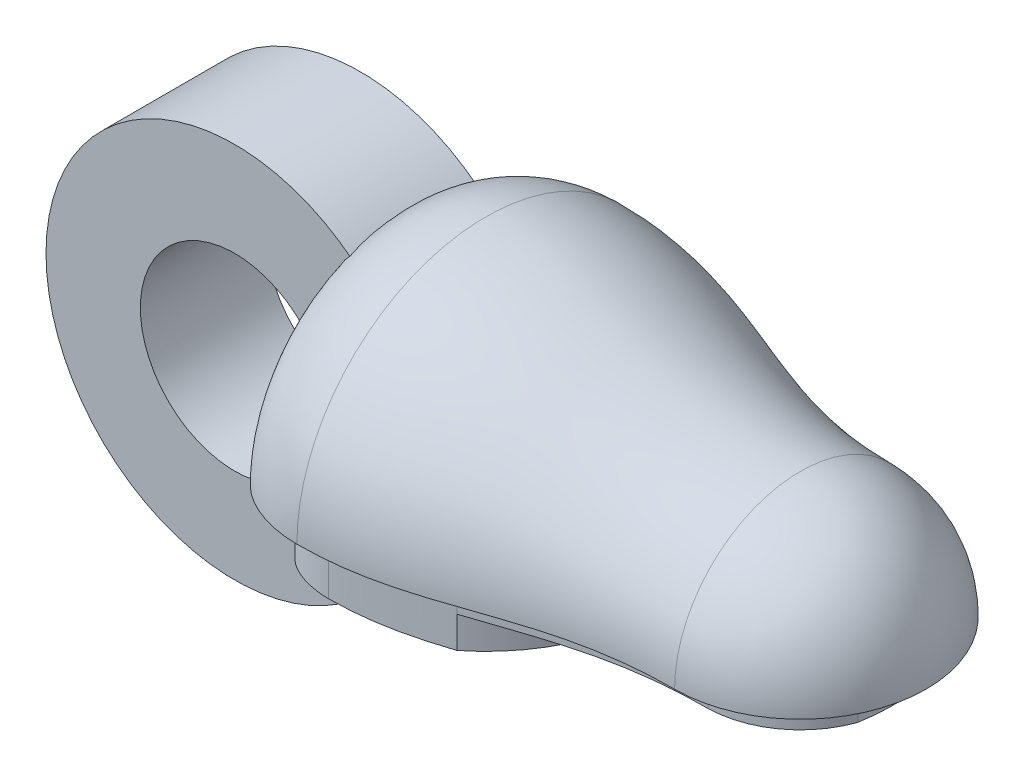
from build123d import *

# Parameters (mm, degrees)
SKETCH6_W               = 12
SKETCH6_H               = 4
BOSS_EXTRUDE2_DEPTH     = 6
SKETCH7_R               = 16
SKETCH7_R_2             = 6
CUT_EXTRUDE_THIN2_DEPTH = 12
SKETCH8_R               = 3
CUT_EXTRUDE2_DEPTH      = 12
REVOLVE1_ANGLE          = 180
BOSS_EXTRUDE11_DEPTH    = 2
BOSS_EXTRUDE13_DEPTH    = 1


with BuildPart() as part:
    # Sketch6 → Boss-Extrude2 (new, symmetric)
    with BuildSketch(Plane(origin=(0, 0, 0), x_dir=(1, 0, 0), z_dir=(0, 1, 0))):
        with Locations((-17.345305401, 3.781372517)):
            Rectangle(SKETCH6_W, SKETCH6_H)
    extrude(amount=BOSS_EXTRUDE2_DEPTH, both=True)

    # Sketch7 → Cut-Extrude-Thin2 (cut)
    with BuildSketch(Plane.XY.offset(-1.781372517)):
        with Locations((-17.345305401, 0)):
            Circle(SKETCH7_R)
        with Locations((-17.345305401, 0)):
            Circle(SKETCH7_R_2, mode=Mode.SUBTRACT)
    extrude(amount=-CUT_EXTRUDE_THIN2_DEPTH, mode=Mode.SUBTRACT)

    # Sketch8 → Cut-Extrude2 (cut)
    with BuildSketch(Plane.XY.offset(-1.781372517)):
        with Locations((-17.345305401, 0)):
            Circle(SKETCH8_R)
    extrude(amount=-CUT_EXTRUDE2_DEPTH, mode=Mode.SUBTRACT)


with BuildPart() as body_2:
    # Sketch1 → Revolve1 (revolve)
    with BuildSketch(Plane(origin=(0, 0, 0), x_dir=(1, 0, 0), z_dir=(0, 1, 0))):
        with BuildLine():
            Line((-11.345305401, 5.781372517), (-11.345305401, 3.770392336))
            Line((-11.345305401, 3.770392336), (2.654694599, 3.770392336))
            ThreePointArc((2.654694599, 3.770392336), (1.483121723, 6.59881946), (-1.345305401, 7.770392336))
            add(Edge.make_bspline(
                [(-11.345305401, 9.781372517), (-7.48522585, 9.781372517), (-5.777106472, 7.770392336), (-1.345305401, 7.770392336)],
                knots=[0, 0, 0, 0, 1, 1, 1, 1], degree=3))
            add(Edge.make_bspline(
                [(-14.345305401, 7.281372517), (-14.345305401, 9.088411284), (-12.647013681, 9.781372517), (-11.345305401, 9.781372517)],
                knots=[0, 0, 0, 0, 1, 1, 1, 1], degree=3))
            Line((-14.345305401, 7.281372517), (-14.345305401, 5.781372517))
            Line((-14.345305401, 5.781372517), (-11.345305401, 5.781372517))
        make_face()
    revolve(axis=Axis((-11.345305401, 0, -3.770392336), (1, 0, 0)), revolution_arc=REVOLVE1_ANGLE)



with BuildPart() as body_3:
    # Sketch12 → Boss-Extrude11 (new body)
    with BuildSketch(Plane.XZ):
        with BuildLine():
            ThreePointArc((-7.874883, -8.165408645), (-5.745305401, -3.770392336), (-7.874883, 0.624623973))
            add(Edge.make_bspline(
                [(-7.874883, 0.624623973), (-8.240898238, 0.743761404), (-8.603317659, 0.852477295), (-9.69701306, 1.122396257), (-10.451277046, 1.238351871), (-11.345305401, 1.240587846)],
                knots=[0.62212328, 0.62212328, 0.62212328, 0.62212328, 0.75, 0.75, 1, 1, 1, 1], degree=3))
            add(Edge.make_bspline(
                [(-11.345305401, 1.240587846), (-11.582007877, 1.240587846), (-11.849285505, 1.207609981), (-12.351670994, 1.07080948), (-12.585763817, 0.967279847), (-12.864161044, 0.778080962), (-12.94520926, 0.709704432), (-13.083386121, 0.564249441), (-13.140708796, 0.487393711), (-13.235523473, 0.318901476), (-13.273397716, 0.227078537), (-13.328315744, 0.011928169), (-13.345305401, -0.111850667), (-13.345305401, -0.259412154)],
                knots=[0, 0, 0, 0, 0.25, 0.25, 0.5, 0.5, 0.625, 0.625, 0.75, 0.75, 0.875, 0.875, 1, 1, 1, 1], degree=3))
            Line((-13.345305401, -0.259412154), (-13.345305401, -1.759412154))
            Line((-13.345305401, -1.759412154), (-11.345305401, -1.759412154))
            Line((-11.345305401, -1.759412154), (-11.345305401, -5.781372517))
            Line((-11.345305401, -5.781372517), (-13.345305401, -5.781372517))
            Line((-13.345305401, -5.781372517), (-13.345305401, -7.281372517))
            add(Edge.make_bspline(
                [(-13.345305401, -7.281372517), (-13.345305401, -7.428934004), (-13.328315744, -7.552712841), (-13.273397716, -7.767863208), (-13.235523473, -7.859686147), (-13.140708796, -8.028178383), (-13.083386121, -8.105034112), (-12.94520926, -8.250489103), (-12.864161044, -8.318865634), (-12.585763817, -8.508064518), (-12.351670994, -8.611594151), (-11.849285505, -8.748394652), (-11.582007877, -8.781372517), (-10.467113611, -8.781372517), (-9.725930211, -8.669324615), (-8.630749481, -8.401943176), (-8.255140781, -8.289161605), (-7.874883, -8.165408645)],
                knots=[0, 0, 0, 0, 0.125, 0.125, 0.25, 0.25, 0.375, 0.375, 0.5, 0.5, 0.75, 0.75, 1, 1, 1.927527044, 1.927527044, 2.428310976, 2.428310976, 2.428310976, 2.428310976], degree=3))
        make_face()
    extrude(amount=BOSS_EXTRUDE11_DEPTH)


with BuildPart() as body_2_1:
    add(body_2.part)

    add(body_3.part)  # Boss-Extrude13 merges body 3
    # Sketch16 → Boss-Extrude13 (add)
    with BuildSketch(Plane(origin=(0, 0, 0), x_dir=(1, 0, 0), z_dir=(0, 1, 0))):
        with BuildLine():
            ThreePointArc((1.483121723, 4.770392336), (0.386745406, 6.219882078), (-1.345305401, 6.770392336))
            add(Edge.make_bspline(
                [(-1.345305401, 6.770392336), (-2.528882566, 6.770392336), (-3.547465343, 6.906384511), (-5.357998543, 7.31097153), (-6.148097811, 7.577131291), (-7.223433559, 7.946529451), (-7.550846267, 8.059952539), (-7.874883, 8.165408645)],
                knots=[0, 0, 0, 0, 0.25, 0.25, 0.5, 0.5, 0.615021744, 0.615021744, 0.615021744, 0.615021744], degree=3))
            ThreePointArc((-7.874883, 8.165408645), (-5.745305401, 3.770392336), (-7.874883, -0.624623973))
            add(Edge.make_bspline(
                [(-1.28132467, 0.771074669), (-2.464897042, 0.77444288), (-3.483862699, 0.641349926), (-5.295539937, 0.24191694), (-6.086393441, -0.021993287), (-7.183717201, -0.395456887), (-7.530935751, -0.514699985), (-7.874883, -0.624623973)],
                knots=[0, 0, 0, 0, 0.25, 0.25, 0.5, 0.5, 0.62212328, 0.62212328, 0.62212328, 0.62212328], degree=3))
            ThreePointArc((-1.28132467, 0.771074669), (0.412768427, 1.339512574), (1.483121723, 2.770392336))
            add(Edge.make_bspline(
                [(1.483121723, 2.770392336), (1.575185086, 3.292509607), (1.624892158, 3.966372246), (1.483121723, 4.770392336)],
                knots=[0, 0, 0, 0, 1, 1, 1, 1], degree=3))
        make_face()
    extrude(amount=-BOSS_EXTRUDE13_DEPTH)


solid = Compound([part.part, body_2_1.part])
